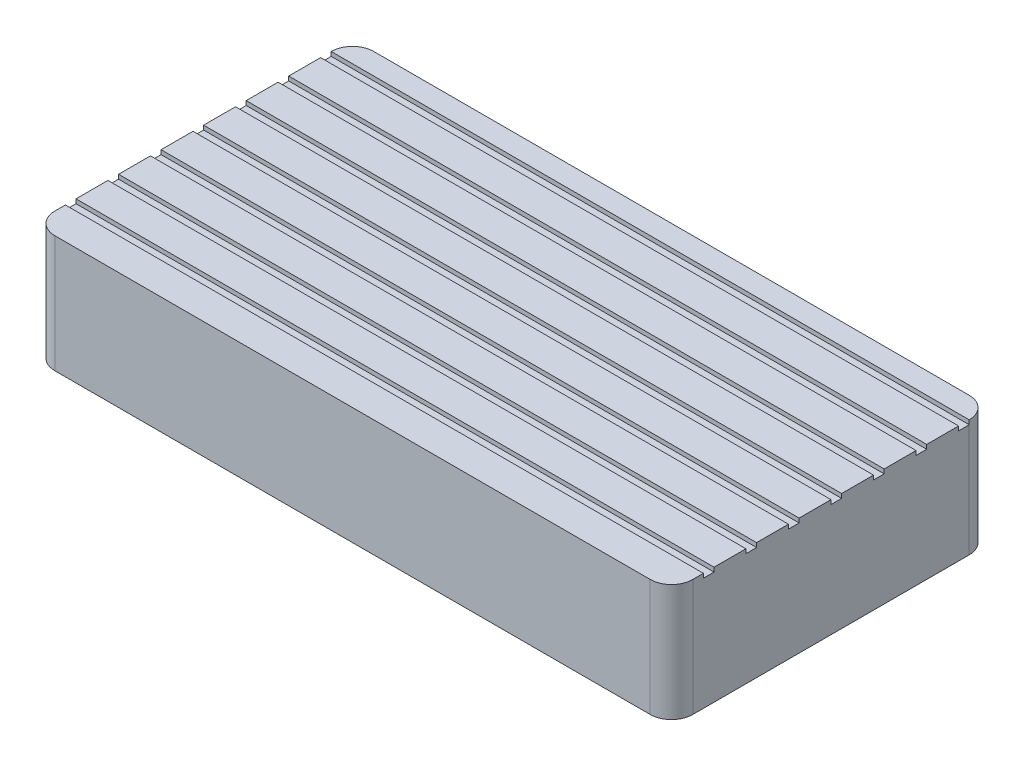
from build123d import *

# Parameters (mm, degrees)
SKETCH1_W               = 30
SKETCH1_H               = 15
BOSS_EXTRUDE1_DEPTH     = 5.5
CUT_EXTRUDE2_DEPTH      = 18.649362595
CUT_EXTRUDE2_DEPTH_BACK = 18.649362595
SKETCH2_W               = 0.5
SKETCH2_H               = 0.2
FILLET1_R               = 1


with BuildPart() as part:
    # Sketch1 → Boss-Extrude1 (new body)
    with BuildSketch(Plane(origin=(0, 0, 0), x_dir=(1, 0, 0), z_dir=(0, 1, 0))):
        Rectangle(SKETCH1_W, SKETCH1_H)
    extrude(amount=BOSS_EXTRUDE1_DEPTH)

    # Sketch2 → Cut-Extrude2 (cut, two sides: drawn at the far end of the back side and taken through both)
    with BuildSketch(Plane(origin=(0, 0, 0), x_dir=(0, 0, -1), z_dir=(1, 0, 0)).offset(-CUT_EXTRUDE2_DEPTH_BACK)):
        with Locations((-5.75, 5.4)):
            Rectangle(SKETCH2_W, SKETCH2_H)
        with Locations((-3.75, 5.4)):
            Rectangle(SKETCH2_W, SKETCH2_H)
        with Locations((-1.75, 5.4)):
            Rectangle(SKETCH2_W, SKETCH2_H)
        with Locations((0.25, 5.4)):
            Rectangle(SKETCH2_W, SKETCH2_H)
        with Locations((2.25, 5.4)):
            Rectangle(SKETCH2_W, SKETCH2_H)
        with Locations((4.25, 5.4)):
            Rectangle(SKETCH2_W, SKETCH2_H)
        with Locations((6.25, 5.4)):
            Rectangle(SKETCH2_W, SKETCH2_H)
    extrude(amount=CUT_EXTRUDE2_DEPTH + CUT_EXTRUDE2_DEPTH_BACK, mode=Mode.SUBTRACT)

    # Fillet1
    fillet1_edges = [part.edges().sort_by_distance(p)[0] for p in [
        (-15, 2.75, -7.5),
        (15, 2.75, -7.5),
        (15, 2.75, 7.5),
        (-15, 2.75, 7.5),
    ]]
    fillet(fillet1_edges, radius=FILLET1_R - 0.0001)  # a hair under: the kernel refuses the full size


solid = part.part
